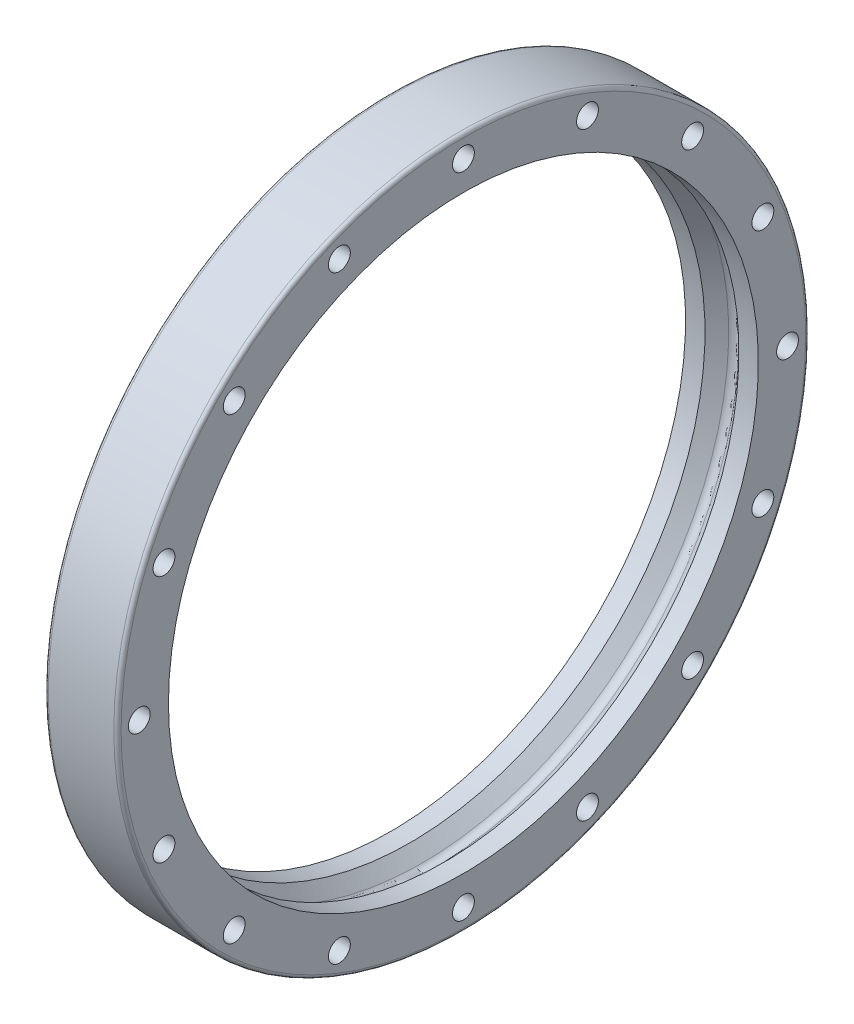
from build123d import *

# Parameters (mm, degrees)
FILLET1_R          = 2
SKETCH2_R          = 3
CUT_EXTRUDE1_DEPTH = 136.830777072
CIRPATTERN1_COUNT  = 16
FILLET2_R          = 1


with BuildPart() as part:
    # Sketch1 → Revolve1 (revolve)
    with BuildSketch(Plane.XY):
        Polygon((-4.656854249, 81), (0, 85.656854249), (4.656854249, 81), (10, 81), (10, 95), (-10, 95), (-10, 81), align=None)
    revolve(axis=Axis((-42.067307692, 0, 0), (1, 0, 0)))

    # Fillet1
    fillet1_edges = [part.edges().sort_by_distance(p)[0] for p in [
        (0, -85.656854249, 0),
    ]]
    fillet(fillet1_edges, radius=FILLET1_R)

    # Sketch2 → Cut-Extrude1 (cut, through all)
    with BuildSketch(Plane(origin=(10, 0, 0), x_dir=(0, 0, -1), z_dir=(1, 0, 0))):
        with Locations((0, 89)):
            Circle(SKETCH2_R)
    cut_extrude1 = extrude(amount=-CUT_EXTRUDE1_DEPTH, mode=Mode.SUBTRACT)

    # CirPattern1: Cut-Extrude1 ×16 about axis
    cirpattern1_axis = Axis((10, 0, 0), (-1, 0, 0))
    for i in range(1, CIRPATTERN1_COUNT):
        add(cut_extrude1.rotate(cirpattern1_axis, i * 360 / CIRPATTERN1_COUNT), mode=Mode.SUBTRACT)

    # Fillet2
    fillet2_edges = [part.edges().sort_by_distance(p)[0] for p in [
        (10, -95, 0),
        (-10, -95, 0),
    ]]
    fillet(fillet2_edges, radius=FILLET2_R)


solid = part.part
